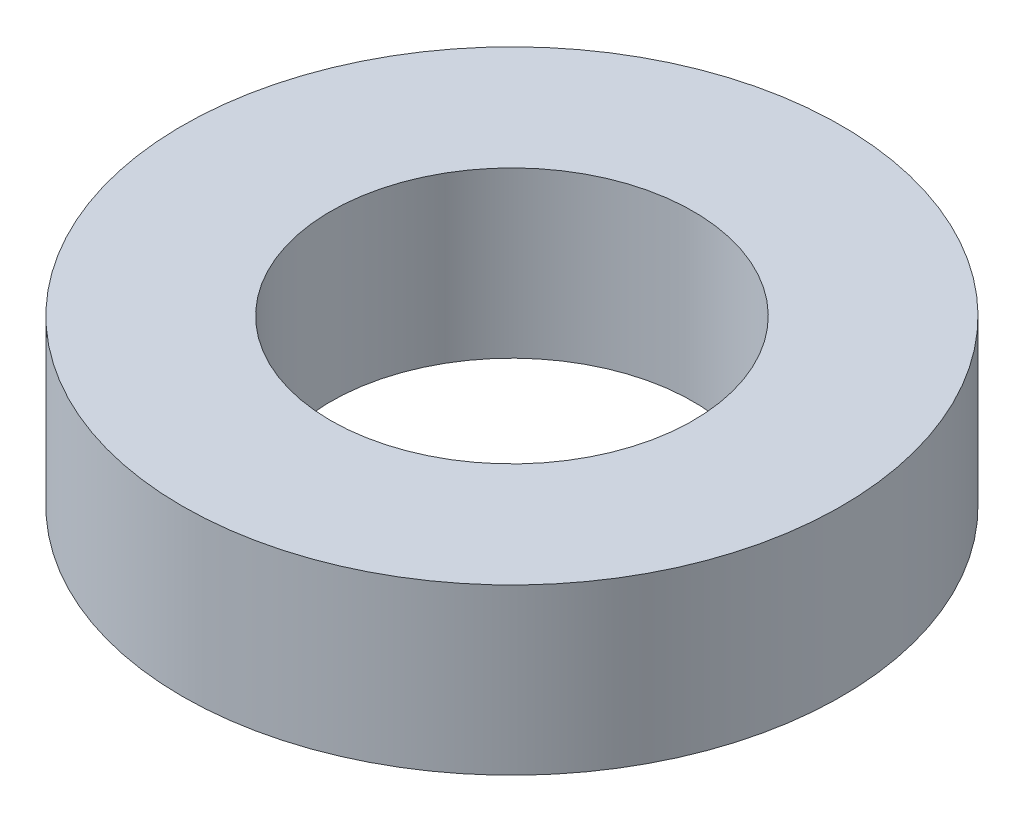
from build123d import *

# Parameters (mm, degrees)
SKETCH1_R           = 2
SKETCH1_R_2         = 1.1
BOSS_EXTRUDE1_DEPTH = 0.5


with BuildPart() as part:
    # Sketch1 → Boss-Extrude1 (new, symmetric)
    with BuildSketch(Plane(origin=(0, 0, 0), x_dir=(1, 0, 0), z_dir=(0, 1, 0))):
        Circle(SKETCH1_R)
        Circle(SKETCH1_R_2, mode=Mode.SUBTRACT)
    extrude(amount=BOSS_EXTRUDE1_DEPTH, both=True)


solid = part.part
